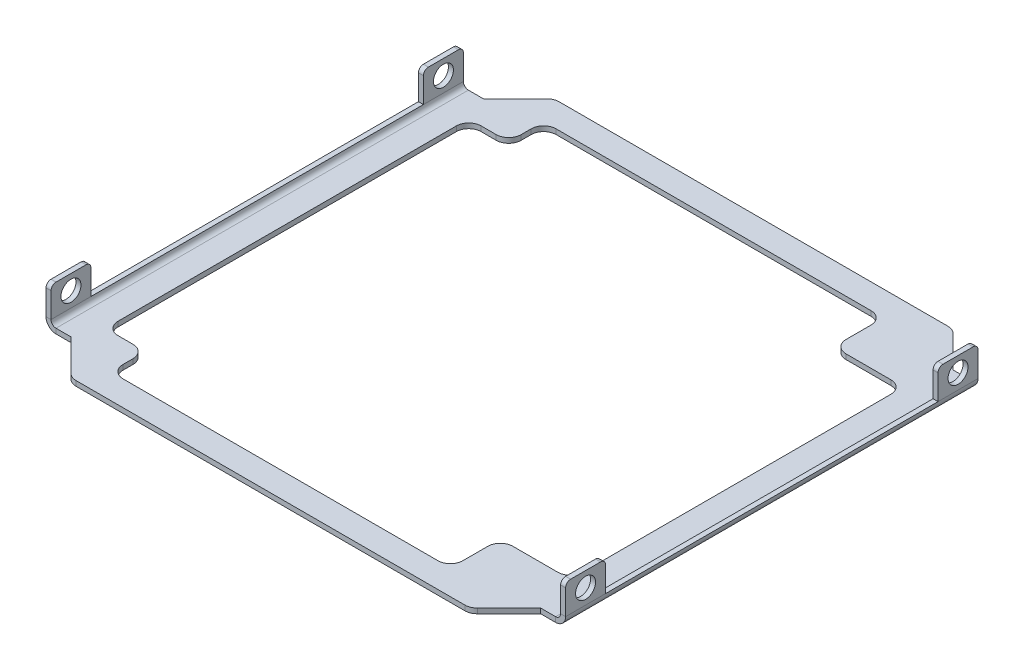
from build123d import *

# Parameters (mm, degrees)
BASE_FLANGE2_DEPTH             = 1
EDGE_FLANGE1_STRIP_W           = 6
EDGE_FLANGE1_STRIP_H           = 1
EDGE_FLANGE1_STRIP_CUT_DEPTH   = 82.6
EDGE_FLANGE1_STRIP_2_W         = 6
EDGE_FLANGE1_STRIP_2_H         = 1
EDGE_FLANGE1_STRIP_CUT_2_DEPTH = 82.6
EDGE_FLANGE1_DEPTH             = 82.6
EDGE_FLANGE1_BEND_DEPTH        = 82.6
SKETCH16_W                     = 66.6
SKETCH16_H                     = 7
CUT_EXTRUDE1_DEPTH             = 138.553195479
FILLET1_R                      = 1
SKETCH17_R                     = 2
CUT_EXTRUDE2_DEPTH             = 138.553195479
CUT_EXTRUDE3_DEPTH             = 138.553195479
FILLET2_R                      = 2.5


# Sheet-metal steps are written as plain solids
with BuildPart() as part:
    # Sketch1 → Base-Flange2 (new body)
    with BuildSketch(Plane(origin=(0, 0, 0), x_dir=(1, 0, 0), z_dir=(0, 1, 0))):
        Polygon((0, 0), (0, 82.6), (5, 82.6), (12.071067812, 89.671067812), (92.000932188, 89.671067812), (99.072, 82.6), (104.072, 82.6), (104.072, 0), (99.072, 0), (92.000932188, -7.071067812), (12.071067812, -7.071067812), (5, 0), align=None)
    extrude(amount=-BASE_FLANGE2_DEPTH)

    # Edge-Flange1 strip (across the edge) → Edge-Flange1 strip cut (cut)
    with BuildSketch(Plane(origin=(104.072, 0, 0), x_dir=(-1, 0, 0), z_dir=(0, 0, -1))):
        with Locations((-1, -0.5)):
            Rectangle(EDGE_FLANGE1_STRIP_W, EDGE_FLANGE1_STRIP_H)
    extrude(amount=EDGE_FLANGE1_STRIP_CUT_DEPTH, mode=Mode.SUBTRACT)

    # Edge-Flange1 strip 2 (across the edge) → Edge-Flange1 strip cut 2 (cut)
    with BuildSketch(Plane.XY.offset(-82.6)):
        with Locations((-1, -0.5)):
            Rectangle(EDGE_FLANGE1_STRIP_2_W, EDGE_FLANGE1_STRIP_2_H)
    extrude(amount=EDGE_FLANGE1_STRIP_CUT_2_DEPTH, mode=Mode.SUBTRACT)

    # Edge-Flange1 section (across the edge) → Edge-Flange1 (add)
    with BuildSketch(Plane(origin=(104.072, 0, 0), x_dir=(-1, 0, 0), z_dir=(0, 0, -1))):
        with BuildLine():
            Line((0, 1), (0, 7))
            Line((0, 7), (1, 7))
            Line((1, 7), (1, 1))
            ThreePointArc((1, 1), (1.292893219, 0.292893219), (2, 0))
            Line((2, 0), (2, -1))
            ThreePointArc((2, -1), (0.585786438, -0.414213562), (0, 1))
        make_face()
    extrude(amount=EDGE_FLANGE1_DEPTH)

    # Edge-Flange1 section 2 (across the edge) → Edge-Flange1 bend (add)
    with BuildSketch(Plane.XY.offset(-82.6)):
        with BuildLine():
            Line((0, 1), (0, 7))
            Line((0, 7), (1, 7))
            Line((1, 7), (1, 1))
            ThreePointArc((1, 1), (1.292893219, 0.292893219), (2, 0))
            Line((2, 0), (2, -1))
            ThreePointArc((2, -1), (0.585786438, -0.414213562), (0, 1))
        make_face()
    extrude(amount=EDGE_FLANGE1_BEND_DEPTH)

    # Sketch16 → Cut-Extrude1 (cut, through all)
    with BuildSketch(Plane(origin=(104.072, 0, 0), x_dir=(0, 0, -1), z_dir=(1, 0, 0))):
        with Locations((41.3, 4.5)):
            Rectangle(SKETCH16_W, SKETCH16_H)
    extrude(amount=-CUT_EXTRUDE1_DEPTH, mode=Mode.SUBTRACT)

    # Fillet1
    fillet1_edges = [part.edges().sort_by_distance(p)[0] for p in [
        (0.5, 7, -74.6),
        (0.5, 7, -8),
        (103.572, 7, -8),
        (103.572, 7, -74.6),
        (103.572, 7, 0),
        (103.572, 7, -82.6),
        (0.5, 7, -82.6),
        (0.5, 7, 0),
    ]]
    fillet(fillet1_edges, radius=FILLET1_R)

    # Sketch17 → Cut-Extrude2 (cut, through all)
    with BuildSketch(Plane(origin=(104.072, 0, 0), x_dir=(0, 0, -1), z_dir=(1, 0, 0))):
        with Locations(Location((4, 4, 0), (0, 0, 90))):
            Circle(SKETCH17_R)
        with Locations(Location((78.6, 4, 0), (0, 0, 90))):
            Circle(SKETCH17_R)
    extrude(amount=-CUT_EXTRUDE2_DEPTH, mode=Mode.SUBTRACT)

    # Sketch19 → Cut-Extrude3 (cut, through all)
    with BuildSketch(Plane(origin=(0, 0, 0), x_dir=(1, 0, 0), z_dir=(0, 1, 0))):
        Polygon((15, -2.071067812), (83.072, -2.071067812), (83.072, 7.928932188), (97.072, 7.928932188), (97.072, 74.671067812), (83.072, 74.671067812), (83.072, 84.671067812), (15, 84.671067812), (15, 77.671067812), (7, 77.671067812), (7, 4.928932188), (15, 4.928932188), align=None)
    extrude(amount=-CUT_EXTRUDE3_DEPTH, mode=Mode.SUBTRACT)

    # Fillet2
    fillet2_edges = [part.edges().sort_by_distance(p)[0] for p in [
        (12.071067812, -0.5, -89.671067812),
        (92.000932188, -0.5, -89.671067812),
        (92.000932188, -0.5, 7.071067812),
        (12.071067812, -0.5, 7.071067812),
        (15, -0.5, 2.071067812),
        (15, -0.5, -4.928932188),
        (7, -0.5, -4.928932188),
        (7, -0.5, -77.671067812),
        (15, -0.5, -77.671067812),
        (15, -0.5, -84.671067812),
        (83.072, -0.5, -84.671067812),
        (83.072, -0.5, -74.671067812),
        (97.072, -0.5, -74.671067812),
        (97.072, -0.5, -7.928932188),
        (83.072, -0.5, -7.928932188),
        (83.072, -0.5, 2.071067812),
    ]]
    fillet(fillet2_edges, radius=FILLET2_R)


solid = part.part
